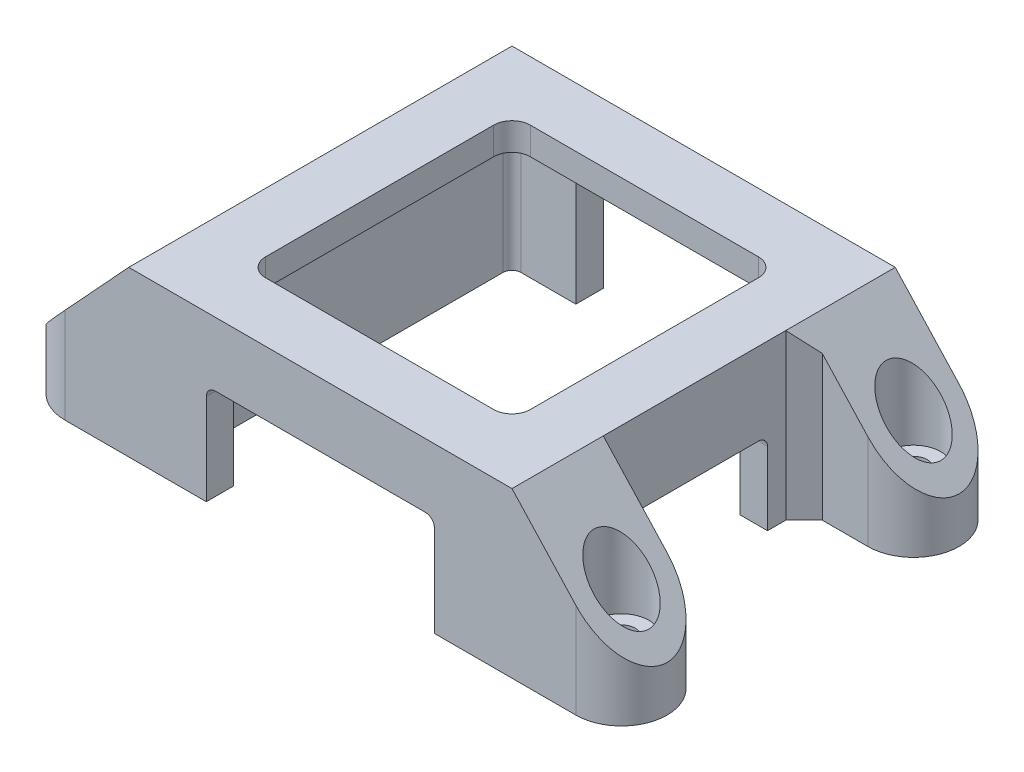
from build123d import *

# Parameters (mm, degrees)
SKETCH1_W             = 36
SKETCH1_H             = 36
BOSS_EXTRUDE1_DEPTH   = 15
SHELL1_T              = 3
CUT_EXTRUDE1_REACH    = 52.289
SKETCH2_W             = 25
SKETCH2_H             = 11
CUT_EXTRUDE2_REACH    = 52.289
SKETCH3_W             = 18
SKETCH3_H             = 9
CUT_EXTRUDE3_REACH    = 36.728
SKETCH5_W             = 29
SKETCH5_H             = 29
FILLET1_R             = 2
CUT_EXTRUDE4_REACH    = 52.289
SKETCH6_W             = 22
SKETCH6_H             = 14
FILLET2_R             = 1
SKETCH9_W             = 12
SKETCH9_H             = 10
BOSS_EXTRUDE3_DEPTH   = 5
BOSS_EXTRUDE4_DEPTH   = 10
SKETCH11_R            = 1.5
CUT_EXTRUDE5_DEPTH    = 5
CUT_EXTRUDE6_REACH    = 43.219
SKETCH12_R            = 3
CUT_EXTRUDE7_REACH    = 45.058
MIRROR3_OUTLINE_R     = 1.5
MIRROR3_DEPTH         = 5
MIRROR3_START         = 5
MIRROR3_2_OUTLINE_R   = 3
MIRROR3_2_DEPTH       = 13
MIRROR3_START_2       = 27.639914186
MIRROR3_3_OUTLINE_W   = 20
MIRROR3_3_OUTLINE_H   = 12
MIRROR3_3_OUTLINE_H_2 = 11
MIRROR3_3_DEPTH       = 9.360085814
CHAMFER1_SIZE         = 2
FILLET3_R             = 1


with BuildPart() as part:
    # Sketch1 → Boss-Extrude1 (new body)
    with BuildSketch(Plane(origin=(0, 0, 0), x_dir=(1, 0, 0), z_dir=(0, 1, 0))):
        Rectangle(SKETCH1_W, SKETCH1_H)
    extrude(amount=BOSS_EXTRUDE1_DEPTH)

    # Shell1
    shell1_openings = [part.faces().sort_by_distance(p)[0] for p in [
        (0, 0, 0),
    ]]
    offset(amount=SHELL1_T, openings=shell1_openings, kind=Kind.INTERSECTION)

    # Sketch2 → Cut-Extrude1 (cut, up to next)
    with BuildSketch(Plane.XY.offset(21), mode=Mode.PRIVATE) as cut_extrude1_sk1:
        with Locations((0, 5.5)):
            Rectangle(SKETCH2_W, SKETCH2_H)
    cut_extrude1_tool1 = extrude(cut_extrude1_sk1.sketch, amount=-CUT_EXTRUDE1_REACH, mode=Mode.PRIVATE) & part.part
    add(cut_extrude1_tool1.solids().sort_by_distance((0, 5.5, 21))[0], mode=Mode.SUBTRACT)

    # Sketch3 → Cut-Extrude2 (cut, up to next)
    with BuildSketch(Plane(origin=(21, 0, 0), x_dir=(0, 0, -1), z_dir=(1, 0, 0)), mode=Mode.PRIVATE) as cut_extrude2_sk1:
        with Locations((-2, 4.5)):
            Rectangle(SKETCH3_W, SKETCH3_H)
    cut_extrude2_tool1 = extrude(cut_extrude2_sk1.sketch, amount=-CUT_EXTRUDE2_REACH, mode=Mode.PRIVATE) & part.part
    add(cut_extrude2_tool1.solids().sort_by_distance((21, 4.5, 2))[0], mode=Mode.SUBTRACT)

    # Sketch5 → Cut-Extrude3 (cut, up to next)
    with BuildSketch(Plane(origin=(0, 18, 0), x_dir=(1, 0, 0), z_dir=(0, 1, 0)), mode=Mode.PRIVATE) as cut_extrude3_sk1:
        Rectangle(SKETCH5_W, SKETCH5_H)
    cut_extrude3_tool1 = extrude(cut_extrude3_sk1.sketch, amount=-CUT_EXTRUDE3_REACH, mode=Mode.PRIVATE) & part.part
    add(cut_extrude3_tool1.solids().sort_by_distance((0, 18, 0))[0], mode=Mode.SUBTRACT)

    # Fillet1
    fillet1_edges = [part.edges().sort_by_distance(p)[0] for p in [
        (14.5, 16.5, -14.5),
        (14.5, 16.5, 14.5),
        (-14.5, 16.5, 14.5),
        (-14.5, 16.5, -14.5),
    ]]
    fillet(fillet1_edges, radius=FILLET1_R)

    # Sketch6 → Cut-Extrude4 (cut, up to next)
    with BuildSketch(Plane(origin=(0, 0, -21), x_dir=(-1, 0, 0), z_dir=(0, 0, -1)), mode=Mode.PRIVATE) as cut_extrude4_sk1:
        with Locations((0, 7)):
            Rectangle(SKETCH6_W, SKETCH6_H)
    cut_extrude4_tool1 = extrude(cut_extrude4_sk1.sketch, amount=-CUT_EXTRUDE4_REACH, mode=Mode.PRIVATE) & part.part
    add(cut_extrude4_tool1.solids().sort_by_distance((0, 7, -21))[0], mode=Mode.SUBTRACT)

    # Fillet2
    fillet2_edges = [part.edges().sort_by_distance(p)[0] for p in [
        (-11, 14, -19.5),
        (11, 14, -19.5),
        (12.5, 11, 19.5),
        (-12.5, 11, 19.5),
        (19.5, 9, 11),
        (19.5, 9, -7),
    ]]
    fillet(fillet2_edges, radius=FILLET2_R)

    # Sketch9 → Boss-Extrude3 (add)
    with BuildSketch(Plane.XZ):
        with Locations((-27, 16)):
            Rectangle(SKETCH9_W, SKETCH9_H)
    boss_extrude3 = extrude(amount=-BOSS_EXTRUDE3_DEPTH)

    # Sketch10 → Boss-Extrude4 (add)
    with BuildSketch(Plane.XY.offset(21)):
        Polygon((-21, 18), (-33, 5), (-21, 5), align=None)
    boss_extrude4 = extrude(amount=-BOSS_EXTRUDE4_DEPTH)

    # Sketch11 → Cut-Extrude5 (cut)
    with BuildSketch(Plane.XZ):
        with Locations(Location((-28, 16, 0), (0, 0, 270))):
            Circle(SKETCH11_R)
    cut_extrude5 = extrude(amount=-CUT_EXTRUDE5_DEPTH, mode=Mode.SUBTRACT)

    # Cut-Extrude6: up to this plane
    cut_extrude6_end = Plane(origin=(-21, 18, -6.691806013), z_dir=(-0.7348034446274878, 0.678280102733066, 0))
    # Sketch12 → Cut-Extrude6 (cut, up to the surface)
    with BuildSketch(Plane.XZ.offset(-5), mode=Mode.PRIVATE) as cut_extrude6_sk1:
        with Locations(Location((-28, 16, 0), (0, 0, 270))):
            Circle(SKETCH12_R)
    cut_extrude6_tool1 = split(extrude(cut_extrude6_sk1.sketch, amount=-CUT_EXTRUDE6_REACH, mode=Mode.PRIVATE), bisect_by=cut_extrude6_end, keep=Keep.BOTH, mode=Mode.PRIVATE)
    cut_extrude6 = cut_extrude6_tool1.solids().sort_by_distance((-28, 5, 16))[0]
    add(cut_extrude6, mode=Mode.SUBTRACT)

    # Cut-Extrude7: up to this plane
    cut_extrude7_end = Plane(origin=(-21, 18, -6.691806013), z_dir=(-0.7348034446274878, 0.678280102733066, 0))
    # Sketch13 → Cut-Extrude7 (cut, up to the surface)
    with BuildSketch(Plane.XZ, mode=Mode.PRIVATE) as cut_extrude7_sk1:
        with BuildLine():
            ThreePointArc((-33, 16), (-31.535533906, 19.535533906), (-28, 21))
            Line((-28, 21), (-33, 21))
            Line((-33, 21), (-33, 16))
        make_face()
    cut_extrude7_tool1 = split(extrude(cut_extrude7_sk1.sketch, amount=-CUT_EXTRUDE7_REACH, mode=Mode.PRIVATE), bisect_by=cut_extrude7_end, keep=Keep.BOTH, mode=Mode.PRIVATE)
    # Sketch13 → Cut-Extrude7 (cut, up to the surface)
    with BuildSketch(Plane.XZ, mode=Mode.PRIVATE) as cut_extrude7_sk2:
        with BuildLine():
            Line((-33, 11), (-28, 11))
            ThreePointArc((-28, 11), (-31.535533906, 12.464466094), (-33, 16))
            Line((-33, 16), (-33, 11))
        make_face()
    cut_extrude7_tool2 = split(extrude(cut_extrude7_sk2.sketch, amount=-CUT_EXTRUDE7_REACH, mode=Mode.PRIVATE), bisect_by=cut_extrude7_end, keep=Keep.BOTH, mode=Mode.PRIVATE)
    cut_extrude7 = cut_extrude7_tool1.solids().sort_by_distance((-31.88316, 0, 19.88316))[0] + cut_extrude7_tool2.solids().sort_by_distance((-31.88316, 0, 12.11684))[0]
    add(cut_extrude7, mode=Mode.SUBTRACT)

    # Mirror1: Boss-Extrude3, Boss-Extrude4, Cut-Extrude5, Cut-Extrude6, Cut-Extrude7 across plane
    add(boss_extrude3.mirror(Plane.XY))
    add(boss_extrude4.mirror(Plane.XY))
    add(cut_extrude5.mirror(Plane.XY), mode=Mode.SUBTRACT)
    add(cut_extrude6.mirror(Plane.XY), mode=Mode.SUBTRACT)
    add(cut_extrude7.mirror(Plane.XY), mode=Mode.SUBTRACT)

    # Mirror3: read off the stored shape, not the designer's step
    # Mirror3 outline → Mirror3 (add)
    # profile 1 of 2: a face of its own
    with BuildSketch(Plane(origin=(0, 0, 0), x_dir=(1, 0, 0), z_dir=(0, 1, 0))):
        with BuildLine():
            Line((21, 21), (21, 11))
            Line((21, 11), (28, 11))
            ThreePointArc((28, 11), (33, 16), (28, 21))
            Line((28, 21), (21, 21))
        make_face()
        with Locations((28, 16)):
            Circle(MIRROR3_OUTLINE_R, mode=Mode.SUBTRACT)
    # profile 2 of 2: a face of its own
    with BuildSketch(Plane(origin=(0, 0, 0), x_dir=(1, 0, 0), z_dir=(0, 1, 0))):
        with BuildLine():
            Line((28, -11), (21, -11))
            Line((21, -11), (21, -21))
            Line((21, -21), (28, -21))
            ThreePointArc((28, -21), (33, -16), (28, -11))
        make_face()
        with Locations((28, -16)):
            Circle(MIRROR3_OUTLINE_R, mode=Mode.SUBTRACT)
    extrude(amount=MIRROR3_DEPTH)

    # Mirror3 2 outline → Mirror3 2 (add)
    # profile 1 of 2: a face of its own
    with BuildSketch(Plane(origin=(0, 0, 0), x_dir=(1, 0, 0), z_dir=(0, 1, 0)).offset(MIRROR3_START)):
        with BuildLine():
            Line((21, 21), (21, 11))
            Line((21, 11), (28, 11))
            ThreePointArc((28, 11), (33, 16), (28, 21))
            Line((28, 21), (21, 21))
        make_face()
        with Locations((28, 16)):
            Circle(MIRROR3_2_OUTLINE_R, mode=Mode.SUBTRACT)
    # profile 2 of 2: a face of its own
    with BuildSketch(Plane(origin=(0, 0, 0), x_dir=(1, 0, 0), z_dir=(0, 1, 0)).offset(MIRROR3_START)):
        with BuildLine():
            Line((28, -11), (21, -11))
            Line((21, -11), (21, -21))
            Line((21, -21), (28, -21))
            ThreePointArc((28, -21), (33, -16), (28, -11))
        make_face()
        with Locations((28, -16)):
            Circle(MIRROR3_2_OUTLINE_R, mode=Mode.SUBTRACT)
    extrude(amount=MIRROR3_2_DEPTH)

    # Mirror3 3 outline → Mirror3 3 (cut)
    with BuildSketch(Plane(origin=(0, 0, 0), x_dir=(0.6782801027330657, -0.734803444627488, 0), z_dir=(0.7348034446274879, 0.6782801027330659, 0)).offset(MIRROR3_START_2)):
        with Locations((10, 17)):
            Rectangle(MIRROR3_3_OUTLINE_W, MIRROR3_3_OUTLINE_H)
        with Locations((10, -16.5)):
            Rectangle(MIRROR3_3_OUTLINE_W, MIRROR3_3_OUTLINE_H_2)
    extrude(amount=MIRROR3_3_DEPTH, mode=Mode.SUBTRACT)

    # Chamfer1
    chamfer1_edges = [part.edges().sort_by_distance(p)[0] for p in [
        (-21, 9, 11),
        (-21, 9, -11),
        (21, 9, -11),
    ]]
    chamfer(chamfer1_edges, length=CHAMFER1_SIZE)

    # Fillet3
    fillet3_edges = [part.edges().sort_by_distance(p)[0] for p in [
        (18, 7.5, 18),
        (18, 7.5, -18),
        (-18, 7.5, -18),
        (-18, 7.5, 18),
    ]]
    fillet(fillet3_edges, radius=FILLET3_R)


solid = part.part
